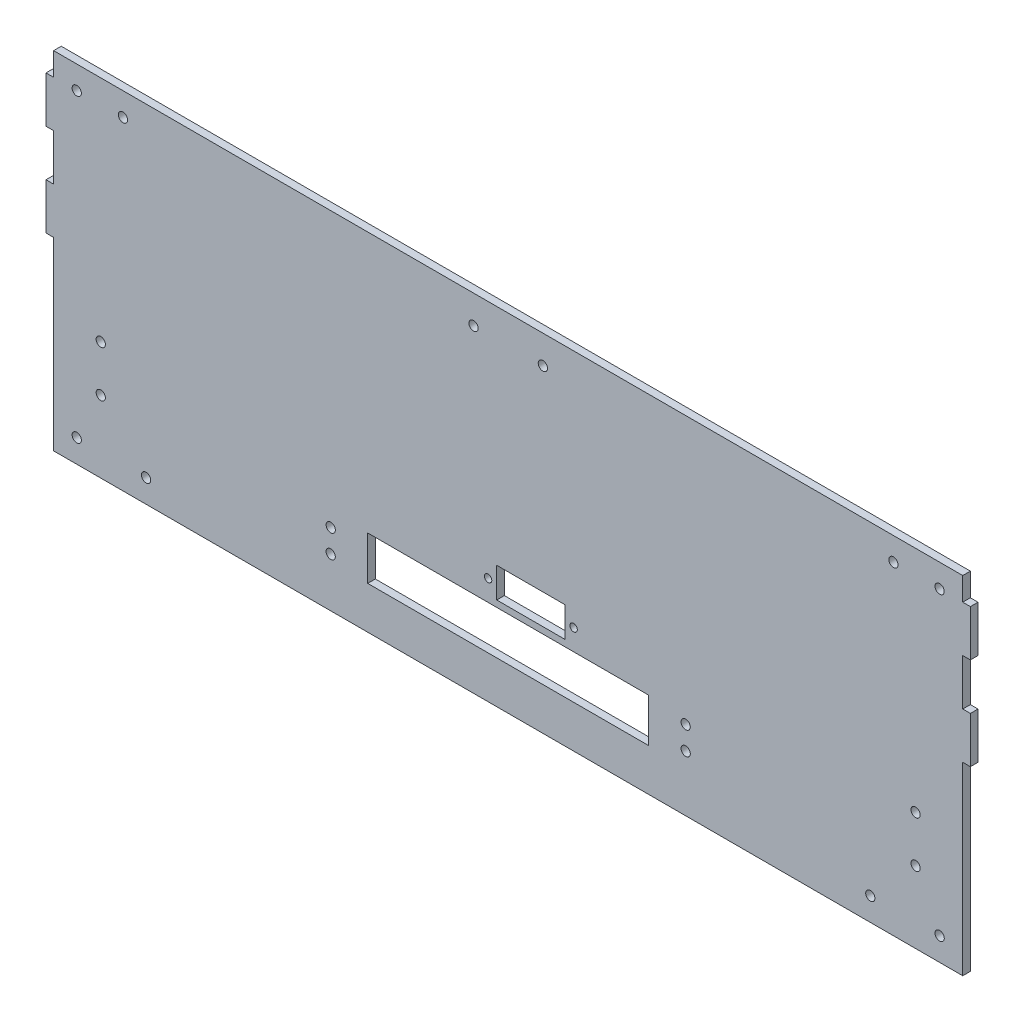
from build123d import *

# Parameters (mm, degrees)
SKETCH1_W           = 393.4
SKETCH1_H           = 150
BOSS_EXTRUDE1_DEPTH = 3.3
SKETCH2_R           = 2
CUT_EXTRUDE1_DEPTH  = 257.520622953
SKETCH3_R           = 2
CUT_EXTRUDE2_DEPTH  = 4
SKETCH4_R           = 2
CUT_EXTRUDE3_DEPTH  = 4
SKETCH6_W           = 29.5
SKETCH6_H           = 13
SKETCH6_W_2         = 121.579447476
SKETCH6_H_2         = 18.9
CUT_EXTRUDE4_DEPTH  = 10
SKETCH7_R           = 2
SKETCH7_R_2         = 1.6
CUT_EXTRUDE5_DEPTH  = 10
SKETCH8_W           = 3.3
SKETCH8_H           = 20
SKETCH8_H_2         = 19.969591437
BOSS_EXTRUDE2_DEPTH = 3.3


with BuildPart() as part:
    # Sketch1 → Boss-Extrude1 (new body)
    with BuildSketch(Plane.XY):
        with Locations((27, -50.5)):
            Rectangle(SKETCH1_W, SKETCH1_H)
    extrude(amount=BOSS_EXTRUDE1_DEPTH)

    # Sketch2 → Cut-Extrude1 (cut, through all)
    with BuildSketch(Plane(origin=(0, 0, 0), x_dir=(-1, 0, 0), z_dir=(0, 0, -1))):
        with Locations((-183.7, -115.5)):
            Circle(SKETCH2_R)
        with Locations((-213.7, -115.5)):
            Circle(SKETCH2_R)
        with Locations((129.7, -115.5)):
            Circle(SKETCH2_R)
        with Locations((159.7, -115.5)):
            Circle(SKETCH2_R)
    extrude(amount=-CUT_EXTRUDE1_DEPTH, mode=Mode.SUBTRACT)

    # Sketch3 → Cut-Extrude2 (cut)
    with BuildSketch(Plane.XY.offset(3.3)):
        with Locations((-159.7, 14.5)):
            Circle(SKETCH3_R)
        with Locations((-139.7, 14.5)):
            Circle(SKETCH3_R)
        with Locations((193.7, 14.5)):
            Circle(SKETCH3_R)
        with Locations((213.7, 14.5)):
            Circle(SKETCH3_R)
    extrude(amount=-CUT_EXTRUDE2_DEPTH, mode=Mode.SUBTRACT)

    # Sketch4 → Cut-Extrude3 (cut)
    with BuildSketch(Plane.XY.offset(3.3)):
        with Locations((12, 12.25)):
            Circle(SKETCH4_R)
        with Locations((42, 12.25)):
            Circle(SKETCH4_R)
    extrude(amount=-CUT_EXTRUDE3_DEPTH, mode=Mode.SUBTRACT)

    # Sketch6 → Cut-Extrude4 (cut)
    with BuildSketch(Plane(origin=(0, 0, 0), x_dir=(-1, 0, 0), z_dir=(0, 0, -1))):
        with Locations((-36.8, -79)):
            Rectangle(SKETCH6_W, SKETCH6_H)
        with Locations((-27, -97.742382112)):
            Rectangle(SKETCH6_W_2, SKETCH6_H_2)
    extrude(amount=-CUT_EXTRUDE4_DEPTH, mode=Mode.SUBTRACT)

    # Sketch7 → Cut-Extrude5 (cut)
    with BuildSketch(Plane.XY.offset(3.3)):
        with Locations((-149.298074337, -74.431790876)):
            Circle(SKETCH7_R)
        with Locations((-149.298074337, -94.431790876)):
            Circle(SKETCH7_R)
        with Locations((-49.797853771, -104.242382112)):
            Circle(SKETCH7_R)
        with Locations((-49.797853771, -94.242382112)):
            Circle(SKETCH7_R)
        with Locations((18.3, -79.226876468)):
            Circle(SKETCH7_R_2)
        with Locations((55.3, -79.226876468)):
            Circle(SKETCH7_R_2)
        with Locations((103.797853771, -91.242382112)):
            Circle(SKETCH7_R)
        with Locations((103.797853771, -101.242382112)):
            Circle(SKETCH7_R)
        with Locations((203.298074337, -74.45)):
            Circle(SKETCH7_R)
        with Locations((203.298074337, -94.45)):
            Circle(SKETCH7_R)
    extrude(amount=-CUT_EXTRUDE5_DEPTH, mode=Mode.SUBTRACT)

    # Sketch8 → Boss-Extrude2 (add)
    with BuildSketch(Plane.XY.offset(3.3)):
        with Locations((-171.35, 4.5)):
            Rectangle(SKETCH8_W, SKETCH8_H)
        with Locations((-171.35, -35.515204282)):
            Rectangle(SKETCH8_W, SKETCH8_H_2)
        with Locations((225.35, -35.515204282)):
            Rectangle(SKETCH8_W, SKETCH8_H_2)
        with Locations((225.35, 4.5)):
            Rectangle(SKETCH8_W, SKETCH8_H)
    extrude(amount=-BOSS_EXTRUDE2_DEPTH)


solid = part.part
